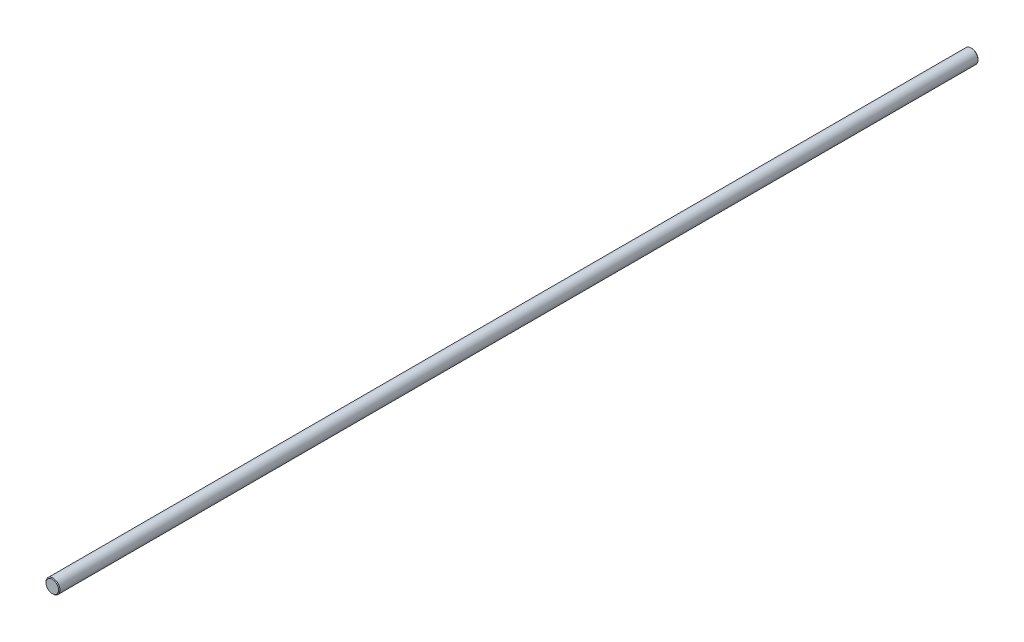
from build123d import *

# Parameters (mm, degrees)
SKETCH1_R           = 4
BOSS_EXTRUDE1_DEPTH = 528
CHAMFER1_SIZE       = 0.4


with BuildPart() as part:
    # Sketch1 → Boss-Extrude1 (new body)
    with BuildSketch(Plane.XY):
        Circle(SKETCH1_R)
    extrude(amount=BOSS_EXTRUDE1_DEPTH)

    # Chamfer1
    chamfer1_edges = [part.edges().sort_by_distance(p)[0] for p in [
        (-4, 0, 0),
        (-4, 0, 528),
    ]]
    chamfer(chamfer1_edges, length=CHAMFER1_SIZE)


solid = part.part
